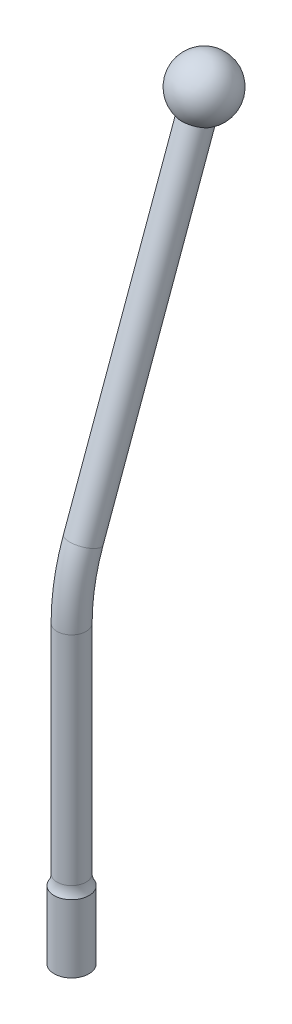
from build123d import *

# Parameters (mm, degrees)
SKETCH_1_R        = 0.9
EXTRUDE_1_DEPTH   = 3.5
SWEEP_1_PROFILE_R = 0.75
FILLET_2_R        = 1


with BuildPart() as part:
    # 草图1 → 凸台-拉伸1 (new body)
    with BuildSketch(Plane(origin=(0, 0, 0), x_dir=(1, 0, 0), z_dir=(0, 1, 0))):
        with Locations(Location((0, 0, 0), (0, 0, 270))):
            Circle(SKETCH_1_R)
    extrude(amount=EXTRUDE_1_DEPTH)

    # 扫描1: sweep along a path in 草图2
    with BuildLine(Plane(origin=(0, 0, 0), x_dir=(0, 0, -1), z_dir=(1, 0, 0))) as sweep_1_path:
        Line((6.840402867, 35.793852416), (0.603073792, 18.656931626))
        ThreePointArc((0.603073792, 18.656931626), (0.15192247, 16.97321197), (0, 15.236730193))
        Line((0, 15.236730193), (0, 3))
    # 扫描1 profile (on start of the path) → 扫描1 (sweep)
    with BuildSketch(Plane(origin=(0, 35.793852416, -6.840402867), x_dir=(0, -0.34202014332566616, -0.9396926207859094), z_dir=(0, -0.9396926207859094, 0.34202014332566616))):
        Circle(SWEEP_1_PROFILE_R)
    sweep(path=sweep_1_path.line)

    # 草图20 one side → 旋转7 (revolve)
    with BuildSketch(Plane(origin=(0, 33.805230182, -12.304097549), x_dir=(1, 0, 0), z_dir=(0, 0.9396926207859094, -0.3420201433256662))):
        with BuildLine():
            ThreePointArc((-1.5, -5.814342437), (0, -7.314342437), (1.5, -5.814342437))
            Line((1.5, -5.814342437), (0.75, -5.814342437))
            ThreePointArc((0.75, -5.814342437), (0, -6.564342437), (-0.75, -5.814342437))
            Line((-0.75, -5.814342437), (-1.5, -5.814342437))
        make_face()
    revolve(axis=Axis((0, 35.793852416, -6.840402867), (-1, 0, 0)))

    # 圆角2
    # the kernel refuses this fillet: 1 mm, written as the material it adds along each edge
    with BuildSketch(Plane(origin=(0, 3.5, 0), x_dir=(0, 0, -1), z_dir=(-1, 0, 0))) as fillet_2_piece_1:
        with BuildLine():
            CenterArc((1.75, -0.526782688), FILLET_2_R, 148.211669382, 31.788330618)
            Line((0.75, -0.526782688), (0.73, -0.526782688))
            Line((0.73, -0.526782688), (0.73, 0))
            Line((0.73, 0), (0.75, 0.02))
            ThreePointArc((0.75, 0.02), (0.825, 0.02), (0.883, 0.010535654))
            Line((0.883, 0.010535654), (0.9, 0))
        make_face()
    revolve(axis=Axis((0, 3.5, 0), (0, -1, 0)))


solid = part.part
